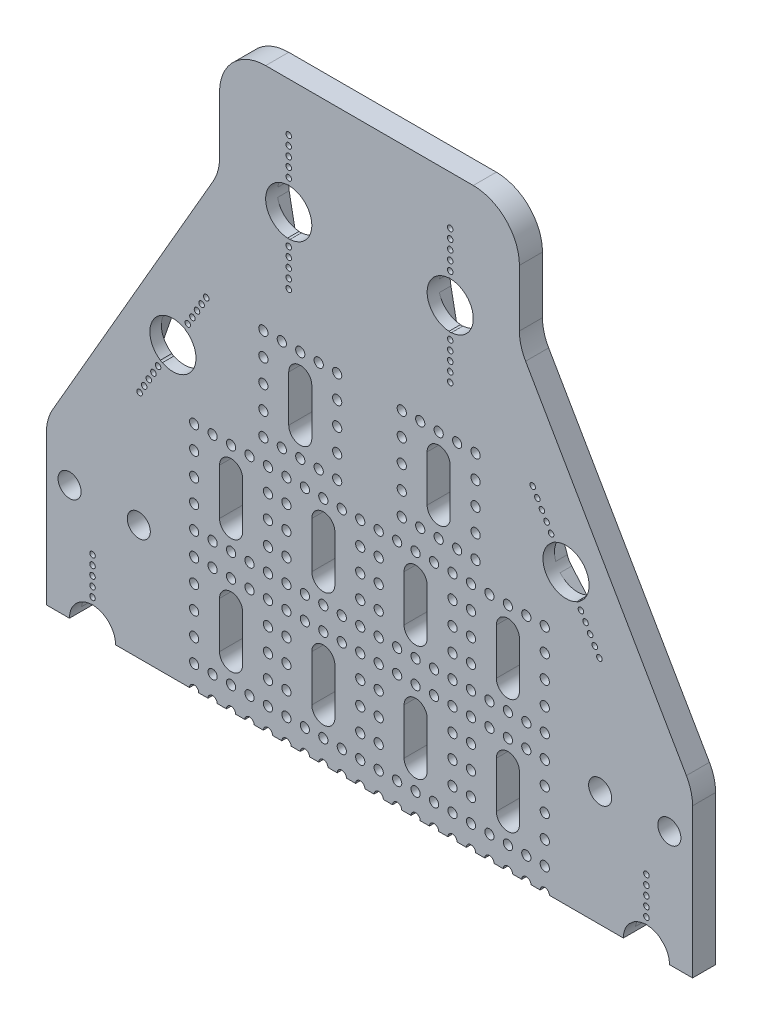
from build123d import *

# Parameters (mm, degrees)
BOSS_EXTRUDE1_DEPTH        = 2.5
SKETCH5_R                  = 1
CUT_EXTRUDE2_DEPTH         = 5
LPATTERN1_COUNT            = 4
LPATTERN1_PITCH            = 20
LPATTERN2_COPY_1_SKETCH_R  = 1
LPATTERN2_COPY_1_DEPTH     = 5
LPATTERN2_COPY_2_SKETCH_R  = 1
LPATTERN2_COPY_2_DEPTH     = 5
LPATTERN2_COPY_3_SKETCH_R  = 1
LPATTERN2_COPY_3_DEPTH     = 5
LPATTERN2_COPY_4_SKETCH_R  = 1
LPATTERN2_COPY_4_DEPTH     = 5
LPATTERN2_COPY_5_SKETCH_R  = 1
LPATTERN2_COPY_5_DEPTH     = 5
LPATTERN2_COPY_6_SKETCH_R  = 1
LPATTERN2_COPY_6_DEPTH     = 5
LPATTERN2_COPY_7_SKETCH_R  = 1
LPATTERN2_COPY_7_DEPTH     = 5
LPATTERN2_COPY_8_SKETCH_R  = 1
LPATTERN2_COPY_8_DEPTH     = 5
LPATTERN2_COPY_9_SKETCH_R  = 1
LPATTERN2_COPY_9_DEPTH     = 5
LPATTERN2_COPY_10_SKETCH_R = 1
LPATTERN2_COPY_10_DEPTH    = 5
LPATTERN2_COPY_11_SKETCH_R = 1
LPATTERN2_COPY_11_DEPTH    = 5
LPATTERN2_COPY_12_SKETCH_R = 1
LPATTERN2_COPY_12_DEPTH    = 5
SKETCH9_W                  = 65
SKETCH9_H                  = 25
BOSS_EXTRUDE6_DEPTH        = 5
SKETCH13_R                 = 1
CUT_EXTRUDE5_DEPTH         = 5
FILLET4_R                  = 10
SKETCH3_R                  = 2.5
CUT_EXTRUDE6_DEPTH         = 5
SKETCH14_R                 = 1
CUT_EXTRUDE7_DEPTH         = 5
SKETCH2_R                  = 5
CUT_EXTRUDE9_DEPTH         = 10
SKETCH15_R                 = 0.6
CUT_EXTRUDE10_DEPTH        = 10
CUT_EXTRUDE11_DEPTH        = 2.5
SKETCH20_R                 = 5
CUT_EXTRUDE12_DEPTH        = 144.366272954
SKETCH21_R                 = 0.6
CUT_EXTRUDE13_DEPTH        = 144.366272954
CUT_EXTRUDE14_DEPTH        = 2.5
SKETCH23_R                 = 2.5
CUT_EXTRUDE15_DEPTH        = 144.366272954
CUT_EXTRUDE16_START        = -10
CUT_EXTRUDE16_DEPTH        = 10


with BuildPart() as part:
    # Sketch1 → Boss-Extrude1 (new, symmetric)
    with BuildSketch(Plane.XY):
        Polygon((32.5, 100), (-32.5, 100), (-70.027767497, 35), (-70.027767497, -35), (-32.5, -100), (32.5, -100), (70.027767497, -35), (70.027767497, 35), align=None)
    extrude(amount=BOSS_EXTRUDE1_DEPTH, both=True)

    # Sketch5 → Cut-Extrude2 (cut)
    with BuildSketch(Plane(origin=(0, 0, -2.5), x_dir=(-1, 0, 0), z_dir=(0, 0, -1))):
        with BuildLine():
            Line((27.5, 45), (27.5, 35))
            ThreePointArc((27.5, 35), (30, 32.5), (32.5, 35))
            Line((32.5, 35), (32.5, 45))
            ThreePointArc((32.5, 45), (30, 47.5), (27.5, 45))
        make_face()
        with Locations((38, 50)):
            Circle(SKETCH5_R)
        with Locations((38, 45)):
            Circle(SKETCH5_R)
        with Locations((38, 40)):
            Circle(SKETCH5_R)
        with Locations((38, 35)):
            Circle(SKETCH5_R)
        with Locations((38, 30)):
            Circle(SKETCH5_R)
        with Locations((22, 30)):
            Circle(SKETCH5_R)
        with Locations((22, 35)):
            Circle(SKETCH5_R)
        with Locations((22, 40)):
            Circle(SKETCH5_R)
        with Locations((22, 45)):
            Circle(SKETCH5_R)
        with Locations((22, 50)):
            Circle(SKETCH5_R)
        with Locations((34, 50)):
            Circle(SKETCH5_R)
        with Locations((30, 50)):
            Circle(SKETCH5_R)
        with Locations((26, 50)):
            Circle(SKETCH5_R)
        with Locations((34, 30)):
            Circle(SKETCH5_R)
        with Locations((30, 30)):
            Circle(SKETCH5_R)
        with Locations((26, 30)):
            Circle(SKETCH5_R)
    cut_extrude2 = extrude(amount=-CUT_EXTRUDE2_DEPTH, mode=Mode.SUBTRACT)

    # LPattern1: Cut-Extrude2 ×4
    with Locations(*[(i * LPATTERN1_PITCH, 0, 0) for i in range(1, LPATTERN1_COUNT)]):
        add(cut_extrude2, mode=Mode.SUBTRACT)

    # LPattern2 copy 1 sketch → LPattern2 copy 1 (cut)
    with BuildSketch(Plane(origin=(20, -25, -2.5), x_dir=(-1, 0, 0), z_dir=(0, 0, -1))):
        with BuildLine():
            Line((27.5, 45), (27.5, 35))
            ThreePointArc((27.5, 35), (30, 32.5), (32.5, 35))
            Line((32.5, 35), (32.5, 45))
            ThreePointArc((32.5, 45), (30, 47.5), (27.5, 45))
        make_face()
        with Locations((38, 50)):
            Circle(LPATTERN2_COPY_1_SKETCH_R)
        with Locations((38, 45)):
            Circle(LPATTERN2_COPY_1_SKETCH_R)
        with Locations((38, 40)):
            Circle(LPATTERN2_COPY_1_SKETCH_R)
        with Locations((38, 35)):
            Circle(LPATTERN2_COPY_1_SKETCH_R)
        with Locations((38, 30)):
            Circle(LPATTERN2_COPY_1_SKETCH_R)
        with Locations((22, 30)):
            Circle(LPATTERN2_COPY_1_SKETCH_R)
        with Locations((22, 35)):
            Circle(LPATTERN2_COPY_1_SKETCH_R)
        with Locations((22, 40)):
            Circle(LPATTERN2_COPY_1_SKETCH_R)
        with Locations((22, 45)):
            Circle(LPATTERN2_COPY_1_SKETCH_R)
        with Locations((22, 50)):
            Circle(LPATTERN2_COPY_1_SKETCH_R)
        with Locations((34, 50)):
            Circle(LPATTERN2_COPY_1_SKETCH_R)
        with Locations((30, 50)):
            Circle(LPATTERN2_COPY_1_SKETCH_R)
        with Locations((26, 50)):
            Circle(LPATTERN2_COPY_1_SKETCH_R)
        with Locations((34, 30)):
            Circle(LPATTERN2_COPY_1_SKETCH_R)
        with Locations((30, 30)):
            Circle(LPATTERN2_COPY_1_SKETCH_R)
        with Locations((26, 30)):
            Circle(LPATTERN2_COPY_1_SKETCH_R)
    extrude(amount=-LPATTERN2_COPY_1_DEPTH, mode=Mode.SUBTRACT)

    # LPattern2 copy 2 sketch → LPattern2 copy 2 (cut)
    with BuildSketch(Plane(origin=(20, -50, -2.5), x_dir=(-1, 0, 0), z_dir=(0, 0, -1))):
        with BuildLine():
            Line((27.5, 45), (27.5, 35))
            ThreePointArc((27.5, 35), (30, 32.5), (32.5, 35))
            Line((32.5, 35), (32.5, 45))
            ThreePointArc((32.5, 45), (30, 47.5), (27.5, 45))
        make_face()
        with Locations((38, 50)):
            Circle(LPATTERN2_COPY_2_SKETCH_R)
        with Locations((38, 45)):
            Circle(LPATTERN2_COPY_2_SKETCH_R)
        with Locations((38, 40)):
            Circle(LPATTERN2_COPY_2_SKETCH_R)
        with Locations((38, 35)):
            Circle(LPATTERN2_COPY_2_SKETCH_R)
        with Locations((38, 30)):
            Circle(LPATTERN2_COPY_2_SKETCH_R)
        with Locations((22, 30)):
            Circle(LPATTERN2_COPY_2_SKETCH_R)
        with Locations((22, 35)):
            Circle(LPATTERN2_COPY_2_SKETCH_R)
        with Locations((22, 40)):
            Circle(LPATTERN2_COPY_2_SKETCH_R)
        with Locations((22, 45)):
            Circle(LPATTERN2_COPY_2_SKETCH_R)
        with Locations((22, 50)):
            Circle(LPATTERN2_COPY_2_SKETCH_R)
        with Locations((34, 50)):
            Circle(LPATTERN2_COPY_2_SKETCH_R)
        with Locations((30, 50)):
            Circle(LPATTERN2_COPY_2_SKETCH_R)
        with Locations((26, 50)):
            Circle(LPATTERN2_COPY_2_SKETCH_R)
        with Locations((34, 30)):
            Circle(LPATTERN2_COPY_2_SKETCH_R)
        with Locations((30, 30)):
            Circle(LPATTERN2_COPY_2_SKETCH_R)
        with Locations((26, 30)):
            Circle(LPATTERN2_COPY_2_SKETCH_R)
    extrude(amount=-LPATTERN2_COPY_2_DEPTH, mode=Mode.SUBTRACT)

    # LPattern2 copy 3 sketch → LPattern2 copy 3 (cut)
    with BuildSketch(Plane(origin=(20, -75, -2.5), x_dir=(-1, 0, 0), z_dir=(0, 0, -1))):
        with BuildLine():
            Line((27.5, 45), (27.5, 35))
            ThreePointArc((27.5, 35), (30, 32.5), (32.5, 35))
            Line((32.5, 35), (32.5, 45))
            ThreePointArc((32.5, 45), (30, 47.5), (27.5, 45))
        make_face()
        with Locations((38, 50)):
            Circle(LPATTERN2_COPY_3_SKETCH_R)
        with Locations((38, 45)):
            Circle(LPATTERN2_COPY_3_SKETCH_R)
        with Locations((38, 40)):
            Circle(LPATTERN2_COPY_3_SKETCH_R)
        with Locations((38, 35)):
            Circle(LPATTERN2_COPY_3_SKETCH_R)
        with Locations((38, 30)):
            Circle(LPATTERN2_COPY_3_SKETCH_R)
        with Locations((22, 30)):
            Circle(LPATTERN2_COPY_3_SKETCH_R)
        with Locations((22, 35)):
            Circle(LPATTERN2_COPY_3_SKETCH_R)
        with Locations((22, 40)):
            Circle(LPATTERN2_COPY_3_SKETCH_R)
        with Locations((22, 45)):
            Circle(LPATTERN2_COPY_3_SKETCH_R)
        with Locations((22, 50)):
            Circle(LPATTERN2_COPY_3_SKETCH_R)
        with Locations((34, 50)):
            Circle(LPATTERN2_COPY_3_SKETCH_R)
        with Locations((30, 50)):
            Circle(LPATTERN2_COPY_3_SKETCH_R)
        with Locations((26, 50)):
            Circle(LPATTERN2_COPY_3_SKETCH_R)
        with Locations((34, 30)):
            Circle(LPATTERN2_COPY_3_SKETCH_R)
        with Locations((30, 30)):
            Circle(LPATTERN2_COPY_3_SKETCH_R)
        with Locations((26, 30)):
            Circle(LPATTERN2_COPY_3_SKETCH_R)
    extrude(amount=-LPATTERN2_COPY_3_DEPTH, mode=Mode.SUBTRACT)

    # LPattern2 copy 4 sketch → LPattern2 copy 4 (cut)
    with BuildSketch(Plane(origin=(40, -25, -2.5), x_dir=(-1, 0, 0), z_dir=(0, 0, -1))):
        with BuildLine():
            Line((27.5, 45), (27.5, 35))
            ThreePointArc((27.5, 35), (30, 32.5), (32.5, 35))
            Line((32.5, 35), (32.5, 45))
            ThreePointArc((32.5, 45), (30, 47.5), (27.5, 45))
        make_face()
        with Locations((38, 50)):
            Circle(LPATTERN2_COPY_4_SKETCH_R)
        with Locations((38, 45)):
            Circle(LPATTERN2_COPY_4_SKETCH_R)
        with Locations((38, 40)):
            Circle(LPATTERN2_COPY_4_SKETCH_R)
        with Locations((38, 35)):
            Circle(LPATTERN2_COPY_4_SKETCH_R)
        with Locations((38, 30)):
            Circle(LPATTERN2_COPY_4_SKETCH_R)
        with Locations((22, 30)):
            Circle(LPATTERN2_COPY_4_SKETCH_R)
        with Locations((22, 35)):
            Circle(LPATTERN2_COPY_4_SKETCH_R)
        with Locations((22, 40)):
            Circle(LPATTERN2_COPY_4_SKETCH_R)
        with Locations((22, 45)):
            Circle(LPATTERN2_COPY_4_SKETCH_R)
        with Locations((22, 50)):
            Circle(LPATTERN2_COPY_4_SKETCH_R)
        with Locations((34, 50)):
            Circle(LPATTERN2_COPY_4_SKETCH_R)
        with Locations((30, 50)):
            Circle(LPATTERN2_COPY_4_SKETCH_R)
        with Locations((26, 50)):
            Circle(LPATTERN2_COPY_4_SKETCH_R)
        with Locations((34, 30)):
            Circle(LPATTERN2_COPY_4_SKETCH_R)
        with Locations((30, 30)):
            Circle(LPATTERN2_COPY_4_SKETCH_R)
        with Locations((26, 30)):
            Circle(LPATTERN2_COPY_4_SKETCH_R)
    extrude(amount=-LPATTERN2_COPY_4_DEPTH, mode=Mode.SUBTRACT)

    # LPattern2 copy 5 sketch → LPattern2 copy 5 (cut)
    with BuildSketch(Plane(origin=(40, -50, -2.5), x_dir=(-1, 0, 0), z_dir=(0, 0, -1))):
        with BuildLine():
            Line((27.5, 45), (27.5, 35))
            ThreePointArc((27.5, 35), (30, 32.5), (32.5, 35))
            Line((32.5, 35), (32.5, 45))
            ThreePointArc((32.5, 45), (30, 47.5), (27.5, 45))
        make_face()
        with Locations((38, 50)):
            Circle(LPATTERN2_COPY_5_SKETCH_R)
        with Locations((38, 45)):
            Circle(LPATTERN2_COPY_5_SKETCH_R)
        with Locations((38, 40)):
            Circle(LPATTERN2_COPY_5_SKETCH_R)
        with Locations((38, 35)):
            Circle(LPATTERN2_COPY_5_SKETCH_R)
        with Locations((38, 30)):
            Circle(LPATTERN2_COPY_5_SKETCH_R)
        with Locations((22, 30)):
            Circle(LPATTERN2_COPY_5_SKETCH_R)
        with Locations((22, 35)):
            Circle(LPATTERN2_COPY_5_SKETCH_R)
        with Locations((22, 40)):
            Circle(LPATTERN2_COPY_5_SKETCH_R)
        with Locations((22, 45)):
            Circle(LPATTERN2_COPY_5_SKETCH_R)
        with Locations((22, 50)):
            Circle(LPATTERN2_COPY_5_SKETCH_R)
        with Locations((34, 50)):
            Circle(LPATTERN2_COPY_5_SKETCH_R)
        with Locations((30, 50)):
            Circle(LPATTERN2_COPY_5_SKETCH_R)
        with Locations((26, 50)):
            Circle(LPATTERN2_COPY_5_SKETCH_R)
        with Locations((34, 30)):
            Circle(LPATTERN2_COPY_5_SKETCH_R)
        with Locations((30, 30)):
            Circle(LPATTERN2_COPY_5_SKETCH_R)
        with Locations((26, 30)):
            Circle(LPATTERN2_COPY_5_SKETCH_R)
    extrude(amount=-LPATTERN2_COPY_5_DEPTH, mode=Mode.SUBTRACT)

    # LPattern2 copy 6 sketch → LPattern2 copy 6 (cut)
    with BuildSketch(Plane(origin=(40, -75, -2.5), x_dir=(-1, 0, 0), z_dir=(0, 0, -1))):
        with BuildLine():
            Line((27.5, 45), (27.5, 35))
            ThreePointArc((27.5, 35), (30, 32.5), (32.5, 35))
            Line((32.5, 35), (32.5, 45))
            ThreePointArc((32.5, 45), (30, 47.5), (27.5, 45))
        make_face()
        with Locations((38, 50)):
            Circle(LPATTERN2_COPY_6_SKETCH_R)
        with Locations((38, 45)):
            Circle(LPATTERN2_COPY_6_SKETCH_R)
        with Locations((38, 40)):
            Circle(LPATTERN2_COPY_6_SKETCH_R)
        with Locations((38, 35)):
            Circle(LPATTERN2_COPY_6_SKETCH_R)
        with Locations((38, 30)):
            Circle(LPATTERN2_COPY_6_SKETCH_R)
        with Locations((22, 30)):
            Circle(LPATTERN2_COPY_6_SKETCH_R)
        with Locations((22, 35)):
            Circle(LPATTERN2_COPY_6_SKETCH_R)
        with Locations((22, 40)):
            Circle(LPATTERN2_COPY_6_SKETCH_R)
        with Locations((22, 45)):
            Circle(LPATTERN2_COPY_6_SKETCH_R)
        with Locations((22, 50)):
            Circle(LPATTERN2_COPY_6_SKETCH_R)
        with Locations((34, 50)):
            Circle(LPATTERN2_COPY_6_SKETCH_R)
        with Locations((30, 50)):
            Circle(LPATTERN2_COPY_6_SKETCH_R)
        with Locations((26, 50)):
            Circle(LPATTERN2_COPY_6_SKETCH_R)
        with Locations((34, 30)):
            Circle(LPATTERN2_COPY_6_SKETCH_R)
        with Locations((30, 30)):
            Circle(LPATTERN2_COPY_6_SKETCH_R)
        with Locations((26, 30)):
            Circle(LPATTERN2_COPY_6_SKETCH_R)
    extrude(amount=-LPATTERN2_COPY_6_DEPTH, mode=Mode.SUBTRACT)

    # LPattern2 copy 7 sketch → LPattern2 copy 7 (cut)
    with BuildSketch(Plane(origin=(60, -25, -2.5), x_dir=(-1, 0, 0), z_dir=(0, 0, -1))):
        with BuildLine():
            Line((27.5, 45), (27.5, 35))
            ThreePointArc((27.5, 35), (30, 32.5), (32.5, 35))
            Line((32.5, 35), (32.5, 45))
            ThreePointArc((32.5, 45), (30, 47.5), (27.5, 45))
        make_face()
        with Locations((38, 50)):
            Circle(LPATTERN2_COPY_7_SKETCH_R)
        with Locations((38, 45)):
            Circle(LPATTERN2_COPY_7_SKETCH_R)
        with Locations((38, 40)):
            Circle(LPATTERN2_COPY_7_SKETCH_R)
        with Locations((38, 35)):
            Circle(LPATTERN2_COPY_7_SKETCH_R)
        with Locations((38, 30)):
            Circle(LPATTERN2_COPY_7_SKETCH_R)
        with Locations((22, 30)):
            Circle(LPATTERN2_COPY_7_SKETCH_R)
        with Locations((22, 35)):
            Circle(LPATTERN2_COPY_7_SKETCH_R)
        with Locations((22, 40)):
            Circle(LPATTERN2_COPY_7_SKETCH_R)
        with Locations((22, 45)):
            Circle(LPATTERN2_COPY_7_SKETCH_R)
        with Locations((22, 50)):
            Circle(LPATTERN2_COPY_7_SKETCH_R)
        with Locations((34, 50)):
            Circle(LPATTERN2_COPY_7_SKETCH_R)
        with Locations((30, 50)):
            Circle(LPATTERN2_COPY_7_SKETCH_R)
        with Locations((26, 50)):
            Circle(LPATTERN2_COPY_7_SKETCH_R)
        with Locations((34, 30)):
            Circle(LPATTERN2_COPY_7_SKETCH_R)
        with Locations((30, 30)):
            Circle(LPATTERN2_COPY_7_SKETCH_R)
        with Locations((26, 30)):
            Circle(LPATTERN2_COPY_7_SKETCH_R)
    extrude(amount=-LPATTERN2_COPY_7_DEPTH, mode=Mode.SUBTRACT)

    # LPattern2 copy 8 sketch → LPattern2 copy 8 (cut)
    with BuildSketch(Plane(origin=(60, -50, -2.5), x_dir=(-1, 0, 0), z_dir=(0, 0, -1))):
        with BuildLine():
            Line((27.5, 45), (27.5, 35))
            ThreePointArc((27.5, 35), (30, 32.5), (32.5, 35))
            Line((32.5, 35), (32.5, 45))
            ThreePointArc((32.5, 45), (30, 47.5), (27.5, 45))
        make_face()
        with Locations((38, 50)):
            Circle(LPATTERN2_COPY_8_SKETCH_R)
        with Locations((38, 45)):
            Circle(LPATTERN2_COPY_8_SKETCH_R)
        with Locations((38, 40)):
            Circle(LPATTERN2_COPY_8_SKETCH_R)
        with Locations((38, 35)):
            Circle(LPATTERN2_COPY_8_SKETCH_R)
        with Locations((38, 30)):
            Circle(LPATTERN2_COPY_8_SKETCH_R)
        with Locations((22, 30)):
            Circle(LPATTERN2_COPY_8_SKETCH_R)
        with Locations((22, 35)):
            Circle(LPATTERN2_COPY_8_SKETCH_R)
        with Locations((22, 40)):
            Circle(LPATTERN2_COPY_8_SKETCH_R)
        with Locations((22, 45)):
            Circle(LPATTERN2_COPY_8_SKETCH_R)
        with Locations((22, 50)):
            Circle(LPATTERN2_COPY_8_SKETCH_R)
        with Locations((34, 50)):
            Circle(LPATTERN2_COPY_8_SKETCH_R)
        with Locations((30, 50)):
            Circle(LPATTERN2_COPY_8_SKETCH_R)
        with Locations((26, 50)):
            Circle(LPATTERN2_COPY_8_SKETCH_R)
        with Locations((34, 30)):
            Circle(LPATTERN2_COPY_8_SKETCH_R)
        with Locations((30, 30)):
            Circle(LPATTERN2_COPY_8_SKETCH_R)
        with Locations((26, 30)):
            Circle(LPATTERN2_COPY_8_SKETCH_R)
    extrude(amount=-LPATTERN2_COPY_8_DEPTH, mode=Mode.SUBTRACT)

    # LPattern2 copy 9 sketch → LPattern2 copy 9 (cut)
    with BuildSketch(Plane(origin=(60, -75, -2.5), x_dir=(-1, 0, 0), z_dir=(0, 0, -1))):
        with BuildLine():
            Line((27.5, 45), (27.5, 35))
            ThreePointArc((27.5, 35), (30, 32.5), (32.5, 35))
            Line((32.5, 35), (32.5, 45))
            ThreePointArc((32.5, 45), (30, 47.5), (27.5, 45))
        make_face()
        with Locations((38, 50)):
            Circle(LPATTERN2_COPY_9_SKETCH_R)
        with Locations((38, 45)):
            Circle(LPATTERN2_COPY_9_SKETCH_R)
        with Locations((38, 40)):
            Circle(LPATTERN2_COPY_9_SKETCH_R)
        with Locations((38, 35)):
            Circle(LPATTERN2_COPY_9_SKETCH_R)
        with Locations((38, 30)):
            Circle(LPATTERN2_COPY_9_SKETCH_R)
        with Locations((22, 30)):
            Circle(LPATTERN2_COPY_9_SKETCH_R)
        with Locations((22, 35)):
            Circle(LPATTERN2_COPY_9_SKETCH_R)
        with Locations((22, 40)):
            Circle(LPATTERN2_COPY_9_SKETCH_R)
        with Locations((22, 45)):
            Circle(LPATTERN2_COPY_9_SKETCH_R)
        with Locations((22, 50)):
            Circle(LPATTERN2_COPY_9_SKETCH_R)
        with Locations((34, 50)):
            Circle(LPATTERN2_COPY_9_SKETCH_R)
        with Locations((30, 50)):
            Circle(LPATTERN2_COPY_9_SKETCH_R)
        with Locations((26, 50)):
            Circle(LPATTERN2_COPY_9_SKETCH_R)
        with Locations((34, 30)):
            Circle(LPATTERN2_COPY_9_SKETCH_R)
        with Locations((30, 30)):
            Circle(LPATTERN2_COPY_9_SKETCH_R)
        with Locations((26, 30)):
            Circle(LPATTERN2_COPY_9_SKETCH_R)
    extrude(amount=-LPATTERN2_COPY_9_DEPTH, mode=Mode.SUBTRACT)

    # LPattern2 copy 10 sketch → LPattern2 copy 10 (cut)
    with BuildSketch(Plane(origin=(0, -25, -2.5), x_dir=(-1, 0, 0), z_dir=(0, 0, -1))):
        with BuildLine():
            Line((27.5, 45), (27.5, 35))
            ThreePointArc((27.5, 35), (30, 32.5), (32.5, 35))
            Line((32.5, 35), (32.5, 45))
            ThreePointArc((32.5, 45), (30, 47.5), (27.5, 45))
        make_face()
        with Locations((38, 50)):
            Circle(LPATTERN2_COPY_10_SKETCH_R)
        with Locations((38, 45)):
            Circle(LPATTERN2_COPY_10_SKETCH_R)
        with Locations((38, 40)):
            Circle(LPATTERN2_COPY_10_SKETCH_R)
        with Locations((38, 35)):
            Circle(LPATTERN2_COPY_10_SKETCH_R)
        with Locations((38, 30)):
            Circle(LPATTERN2_COPY_10_SKETCH_R)
        with Locations((22, 30)):
            Circle(LPATTERN2_COPY_10_SKETCH_R)
        with Locations((22, 35)):
            Circle(LPATTERN2_COPY_10_SKETCH_R)
        with Locations((22, 40)):
            Circle(LPATTERN2_COPY_10_SKETCH_R)
        with Locations((22, 45)):
            Circle(LPATTERN2_COPY_10_SKETCH_R)
        with Locations((22, 50)):
            Circle(LPATTERN2_COPY_10_SKETCH_R)
        with Locations((34, 50)):
            Circle(LPATTERN2_COPY_10_SKETCH_R)
        with Locations((30, 50)):
            Circle(LPATTERN2_COPY_10_SKETCH_R)
        with Locations((26, 50)):
            Circle(LPATTERN2_COPY_10_SKETCH_R)
        with Locations((34, 30)):
            Circle(LPATTERN2_COPY_10_SKETCH_R)
        with Locations((30, 30)):
            Circle(LPATTERN2_COPY_10_SKETCH_R)
        with Locations((26, 30)):
            Circle(LPATTERN2_COPY_10_SKETCH_R)
    extrude(amount=-LPATTERN2_COPY_10_DEPTH, mode=Mode.SUBTRACT)

    # LPattern2 copy 11 sketch → LPattern2 copy 11 (cut)
    with BuildSketch(Plane(origin=(0, -50, -2.5), x_dir=(-1, 0, 0), z_dir=(0, 0, -1))):
        with BuildLine():
            Line((27.5, 45), (27.5, 35))
            ThreePointArc((27.5, 35), (30, 32.5), (32.5, 35))
            Line((32.5, 35), (32.5, 45))
            ThreePointArc((32.5, 45), (30, 47.5), (27.5, 45))
        make_face()
        with Locations((38, 50)):
            Circle(LPATTERN2_COPY_11_SKETCH_R)
        with Locations((38, 45)):
            Circle(LPATTERN2_COPY_11_SKETCH_R)
        with Locations((38, 40)):
            Circle(LPATTERN2_COPY_11_SKETCH_R)
        with Locations((38, 35)):
            Circle(LPATTERN2_COPY_11_SKETCH_R)
        with Locations((38, 30)):
            Circle(LPATTERN2_COPY_11_SKETCH_R)
        with Locations((22, 30)):
            Circle(LPATTERN2_COPY_11_SKETCH_R)
        with Locations((22, 35)):
            Circle(LPATTERN2_COPY_11_SKETCH_R)
        with Locations((22, 40)):
            Circle(LPATTERN2_COPY_11_SKETCH_R)
        with Locations((22, 45)):
            Circle(LPATTERN2_COPY_11_SKETCH_R)
        with Locations((22, 50)):
            Circle(LPATTERN2_COPY_11_SKETCH_R)
        with Locations((34, 50)):
            Circle(LPATTERN2_COPY_11_SKETCH_R)
        with Locations((30, 50)):
            Circle(LPATTERN2_COPY_11_SKETCH_R)
        with Locations((26, 50)):
            Circle(LPATTERN2_COPY_11_SKETCH_R)
        with Locations((34, 30)):
            Circle(LPATTERN2_COPY_11_SKETCH_R)
        with Locations((30, 30)):
            Circle(LPATTERN2_COPY_11_SKETCH_R)
        with Locations((26, 30)):
            Circle(LPATTERN2_COPY_11_SKETCH_R)
    extrude(amount=-LPATTERN2_COPY_11_DEPTH, mode=Mode.SUBTRACT)

    # LPattern2 copy 12 sketch → LPattern2 copy 12 (cut)
    with BuildSketch(Plane(origin=(0, -75, -2.5), x_dir=(-1, 0, 0), z_dir=(0, 0, -1))):
        with BuildLine():
            Line((27.5, 45), (27.5, 35))
            ThreePointArc((27.5, 35), (30, 32.5), (32.5, 35))
            Line((32.5, 35), (32.5, 45))
            ThreePointArc((32.5, 45), (30, 47.5), (27.5, 45))
        make_face()
        with Locations((38, 50)):
            Circle(LPATTERN2_COPY_12_SKETCH_R)
        with Locations((38, 45)):
            Circle(LPATTERN2_COPY_12_SKETCH_R)
        with Locations((38, 40)):
            Circle(LPATTERN2_COPY_12_SKETCH_R)
        with Locations((38, 35)):
            Circle(LPATTERN2_COPY_12_SKETCH_R)
        with Locations((38, 30)):
            Circle(LPATTERN2_COPY_12_SKETCH_R)
        with Locations((22, 30)):
            Circle(LPATTERN2_COPY_12_SKETCH_R)
        with Locations((22, 35)):
            Circle(LPATTERN2_COPY_12_SKETCH_R)
        with Locations((22, 40)):
            Circle(LPATTERN2_COPY_12_SKETCH_R)
        with Locations((22, 45)):
            Circle(LPATTERN2_COPY_12_SKETCH_R)
        with Locations((22, 50)):
            Circle(LPATTERN2_COPY_12_SKETCH_R)
        with Locations((34, 50)):
            Circle(LPATTERN2_COPY_12_SKETCH_R)
        with Locations((30, 50)):
            Circle(LPATTERN2_COPY_12_SKETCH_R)
        with Locations((26, 50)):
            Circle(LPATTERN2_COPY_12_SKETCH_R)
        with Locations((34, 30)):
            Circle(LPATTERN2_COPY_12_SKETCH_R)
        with Locations((30, 30)):
            Circle(LPATTERN2_COPY_12_SKETCH_R)
        with Locations((26, 30)):
            Circle(LPATTERN2_COPY_12_SKETCH_R)
    extrude(amount=-LPATTERN2_COPY_12_DEPTH, mode=Mode.SUBTRACT)

    # Sketch9 → Boss-Extrude6 (add)
    with BuildSketch(Plane(origin=(0, 0, -2.5), x_dir=(-1, 0, 0), z_dir=(0, 0, -1))):
        with Locations((0, 112.5)):
            Rectangle(SKETCH9_W, SKETCH9_H)
    extrude(amount=-BOSS_EXTRUDE6_DEPTH)

    # Sketch13 → Cut-Extrude5 (cut)
    with BuildSketch(Plane(origin=(0, 0, -2.5), x_dir=(-1, 0, 0), z_dir=(0, 0, -1))):
        with BuildLine():
            Line((12.5, 70), (12.5, 60))
            ThreePointArc((12.5, 60), (15, 57.5), (17.5, 60))
            Line((17.5, 60), (17.5, 70))
            ThreePointArc((17.5, 70), (15, 72.5), (12.5, 70))
        make_face()
        with BuildLine():
            Line((-17.5, 70), (-17.5, 60))
            ThreePointArc((-17.5, 60), (-15, 57.5), (-12.5, 60))
            Line((-12.5, 60), (-12.5, 70))
            ThreePointArc((-12.5, 70), (-15, 72.5), (-17.5, 70))
        make_face()
        with Locations((23, 75)):
            Circle(SKETCH13_R)
        with Locations((23, 70)):
            Circle(SKETCH13_R)
        with Locations((23, 65)):
            Circle(SKETCH13_R)
        with Locations((23, 60)):
            Circle(SKETCH13_R)
        with Locations((23, 55)):
            Circle(SKETCH13_R)
        with Locations((7, 55)):
            Circle(SKETCH13_R)
        with Locations((7, 60)):
            Circle(SKETCH13_R)
        with Locations((7, 65)):
            Circle(SKETCH13_R)
        with Locations((7, 70)):
            Circle(SKETCH13_R)
        with Locations((7, 75)):
            Circle(SKETCH13_R)
        with Locations((19, 75)):
            Circle(SKETCH13_R)
        with Locations((15, 75)):
            Circle(SKETCH13_R)
        with Locations((11, 75)):
            Circle(SKETCH13_R)
        with Locations((19, 55)):
            Circle(SKETCH13_R)
        with Locations((15, 55)):
            Circle(SKETCH13_R)
        with Locations((11, 55)):
            Circle(SKETCH13_R)
        with Locations((-11, 55)):
            Circle(SKETCH13_R)
        with Locations((-15, 55)):
            Circle(SKETCH13_R)
        with Locations((-19, 55)):
            Circle(SKETCH13_R)
        with Locations((-11, 75)):
            Circle(SKETCH13_R)
        with Locations((-15, 75)):
            Circle(SKETCH13_R)
        with Locations((-19, 75)):
            Circle(SKETCH13_R)
        with Locations((-7, 75)):
            Circle(SKETCH13_R)
        with Locations((-7, 70)):
            Circle(SKETCH13_R)
        with Locations((-7, 65)):
            Circle(SKETCH13_R)
        with Locations((-7, 60)):
            Circle(SKETCH13_R)
        with Locations((-7, 55)):
            Circle(SKETCH13_R)
        with Locations((-23, 55)):
            Circle(SKETCH13_R)
        with Locations((-23, 60)):
            Circle(SKETCH13_R)
        with Locations((-23, 65)):
            Circle(SKETCH13_R)
        with Locations((-23, 70)):
            Circle(SKETCH13_R)
        with Locations((-23, 75)):
            Circle(SKETCH13_R)
    extrude(amount=-CUT_EXTRUDE5_DEPTH, mode=Mode.SUBTRACT)

    # Fillet4
    fillet4_edges = [part.edges().sort_by_distance(p)[0] for p in [
        (70.027767497, -35, 0),
        (-32.5, -100, 0),
        (32.5, -100, 0),
        (-70.027767497, -35, 0),
        (-70.027767497, 35, 0),
        (70.027767497, 35, 0),
        (32.5, 100, 0),
        (-32.5, 100, 0),
        (-32.5, 125, 0),
        (32.5, 125, 0),
    ]]
    fillet(fillet4_edges, radius=FILLET4_R)

    # Sketch3 → Cut-Extrude6 (cut)
    with BuildSketch(Plane(origin=(0, 0, -2.5), x_dir=(-1, 0, 0), z_dir=(0, 0, -1))):
        with Locations((17.67766953, -57.32233047)):
            Circle(SKETCH3_R)
        with Locations((-17.67766953, -57.32233047)):
            Circle(SKETCH3_R)
        with Locations((17.67766953, -92.67766953)):
            Circle(SKETCH3_R)
        with Locations((-17.67766953, -92.67766953)):
            Circle(SKETCH3_R)
    extrude(amount=-CUT_EXTRUDE6_DEPTH, mode=Mode.SUBTRACT)

    # Sketch14 → Cut-Extrude7 (cut)
    with BuildSketch(Plane(origin=(0, 0, -2.5), x_dir=(-1, 0, 0), z_dir=(0, 0, -1))):
        with BuildLine():
            Line((-2.5, -70), (-2.5, -80))
            ThreePointArc((-2.5, -80), (0, -82.5), (2.5, -80))
            Line((2.5, -80), (2.5, -70))
            ThreePointArc((2.5, -70), (0, -67.5), (-2.5, -70))
        make_face()
        with Locations((8, -65)):
            Circle(SKETCH14_R)
        with Locations((8, -70)):
            Circle(SKETCH14_R)
        with Locations((8, -75)):
            Circle(SKETCH14_R)
        with Locations((8, -80)):
            Circle(SKETCH14_R)
        with Locations((8, -85)):
            Circle(SKETCH14_R)
        with Locations((-8, -85)):
            Circle(SKETCH14_R)
        with Locations((-8, -80)):
            Circle(SKETCH14_R)
        with Locations((-8, -75)):
            Circle(SKETCH14_R)
        with Locations((-8, -70)):
            Circle(SKETCH14_R)
        with Locations((-8, -65)):
            Circle(SKETCH14_R)
        with Locations((4, -65)):
            Circle(SKETCH14_R)
        with Locations((0, -65)):
            Circle(SKETCH14_R)
        with Locations((-4, -65)):
            Circle(SKETCH14_R)
        with Locations((4, -85)):
            Circle(SKETCH14_R)
        with Locations((0, -85)):
            Circle(SKETCH14_R)
        with Locations((-4, -85)):
            Circle(SKETCH14_R)
    extrude(amount=-CUT_EXTRUDE7_DEPTH, mode=Mode.SUBTRACT)

    # Sketch2 → Cut-Extrude9 (cut)
    with BuildSketch(Plane(origin=(0, 0, -2.5), x_dir=(-1, 0, 0), z_dir=(0, 0, -1))):
        with BuildLine():
            ThreePointArc((-56.330934918, 3.366515837), (-56.709449482, 3.650149817), (-57.027767497, 4))
            ThreePointArc((-57.027767497, 4), (-60.027767497, 5), (-63.027767497, 4))
            ThreePointArc((-63.027767497, 4), (-63.346085512, 3.650149817), (-63.724600077, 3.366515837))
            ThreePointArc((-63.724600077, 3.366515837), (-65.027767497, 0), (-63.724600077, -3.366515837))
            ThreePointArc((-63.724600077, -3.366515837), (-63.346085512, -3.650149817), (-63.027767497, -4))
            ThreePointArc((-63.027767497, -4), (-60.027767497, -5), (-57.027767497, -4))
            ThreePointArc((-57.027767497, -4), (-56.709449482, -3.650149817), (-56.330934918, -3.366515837))
            ThreePointArc((-56.330934918, -3.366515837), (-55.027767497, 0), (-56.330934918, 3.366515837))
        make_face()
        with Locations((-42.603629711, 62.5)):
            Circle(SKETCH2_R)
        with Locations((-42.603629711, -62.5)):
            Circle(SKETCH2_R)
        with Locations((42.603629711, -62.5)):
            Circle(SKETCH2_R)
        with Locations((60.027767497, 0)):
            Circle(SKETCH2_R)
        with Locations((42.603629711, 62.5)):
            Circle(SKETCH2_R)
    extrude(amount=-CUT_EXTRUDE9_DEPTH, mode=Mode.SUBTRACT)

    # Sketch15 → Cut-Extrude10 (cut)
    with BuildSketch(Plane(origin=(0, 0, -2.5), x_dir=(-1, 0, 0), z_dir=(0, 0, -1))):
        with Locations((-40.378629711, 66.353813047)):
            Circle(SKETCH15_R)
        with Locations((-39.378629711, 68.085863854)):
            Circle(SKETCH15_R)
        with Locations((-38.378629711, 69.817914662)):
            Circle(SKETCH15_R)
        with Locations((-37.378629711, 71.54996547)):
            Circle(SKETCH15_R)
        with Locations((-36.378629711, 73.282016277)):
            Circle(SKETCH15_R)
        with Locations((-35.378629711, 75.014067085)):
            Circle(SKETCH15_R)
        with Locations((-49.828629711, 49.985932915)):
            Circle(SKETCH15_R)
        with Locations((-48.828629711, 51.717983723)):
            Circle(SKETCH15_R)
        with Locations((-47.828629711, 53.45003453)):
            Circle(SKETCH15_R)
        with Locations((-46.828629711, 55.182085338)):
            Circle(SKETCH15_R)
        with Locations((-45.828629711, 56.914136146)):
            Circle(SKETCH15_R)
        with Locations((-44.828629711, 58.646186953)):
            Circle(SKETCH15_R)
        with Locations((-60.027767497, 4.45)):
            Circle(SKETCH15_R)
        with Locations((-60.027767497, 6.45)):
            Circle(SKETCH15_R)
        with Locations((-60.027767497, 8.45)):
            Circle(SKETCH15_R)
        with Locations((-60.027767497, 10.45)):
            Circle(SKETCH15_R)
        with Locations((-60.027767497, 12.45)):
            Circle(SKETCH15_R)
        with Locations((-60.027767497, 14.45)):
            Circle(SKETCH15_R)
        with Locations((-60.027767497, -14.45)):
            Circle(SKETCH15_R)
        with Locations((-60.027767497, -12.45)):
            Circle(SKETCH15_R)
        with Locations((-60.027767497, -10.45)):
            Circle(SKETCH15_R)
        with Locations((-60.027767497, -8.45)):
            Circle(SKETCH15_R)
        with Locations((-60.027767497, -6.45)):
            Circle(SKETCH15_R)
        with Locations((-60.027767497, -4.45)):
            Circle(SKETCH15_R)
        with Locations((-44.828629711, -58.646186953)):
            Circle(SKETCH15_R)
        with Locations((-45.828629711, -56.914136146)):
            Circle(SKETCH15_R)
        with Locations((-46.828629711, -55.182085338)):
            Circle(SKETCH15_R)
        with Locations((-47.828629711, -53.45003453)):
            Circle(SKETCH15_R)
        with Locations((-48.828629711, -51.717983723)):
            Circle(SKETCH15_R)
        with Locations((-49.828629711, -49.985932915)):
            Circle(SKETCH15_R)
        with Locations((-35.378629711, -75.014067085)):
            Circle(SKETCH15_R)
        with Locations((-36.378629711, -73.282016277)):
            Circle(SKETCH15_R)
        with Locations((-37.378629711, -71.54996547)):
            Circle(SKETCH15_R)
        with Locations((-38.378629711, -69.817914662)):
            Circle(SKETCH15_R)
        with Locations((-39.378629711, -68.085863854)):
            Circle(SKETCH15_R)
        with Locations((-40.378629711, -66.353813047)):
            Circle(SKETCH15_R)
        with Locations((40.378629711, -66.353813047)):
            Circle(SKETCH15_R)
        with Locations((39.378629711, -68.085863854)):
            Circle(SKETCH15_R)
        with Locations((38.378629711, -69.817914662)):
            Circle(SKETCH15_R)
        with Locations((37.378629711, -71.54996547)):
            Circle(SKETCH15_R)
        with Locations((36.378629711, -73.282016277)):
            Circle(SKETCH15_R)
        with Locations((35.378629711, -75.014067085)):
            Circle(SKETCH15_R)
        with Locations((49.828629711, -49.985932915)):
            Circle(SKETCH15_R)
        with Locations((48.828629711, -51.717983723)):
            Circle(SKETCH15_R)
        with Locations((47.828629711, -53.45003453)):
            Circle(SKETCH15_R)
        with Locations((46.828629711, -55.182085338)):
            Circle(SKETCH15_R)
        with Locations((45.828629711, -56.914136146)):
            Circle(SKETCH15_R)
        with Locations((44.828629711, -58.646186953)):
            Circle(SKETCH15_R)
        with Locations((60.027767497, -4.45)):
            Circle(SKETCH15_R)
        with Locations((60.027767497, -6.45)):
            Circle(SKETCH15_R)
        with Locations((60.027767497, -8.45)):
            Circle(SKETCH15_R)
        with Locations((60.027767497, -10.45)):
            Circle(SKETCH15_R)
        with Locations((60.027767497, -12.45)):
            Circle(SKETCH15_R)
        with Locations((60.027767497, -14.45)):
            Circle(SKETCH15_R)
        with Locations((60.027767497, 14.45)):
            Circle(SKETCH15_R)
        with Locations((60.027767497, 12.45)):
            Circle(SKETCH15_R)
        with Locations((60.027767497, 10.45)):
            Circle(SKETCH15_R)
        with Locations((60.027767497, 8.45)):
            Circle(SKETCH15_R)
        with Locations((60.027767497, 6.45)):
            Circle(SKETCH15_R)
        with Locations((60.027767497, 4.45)):
            Circle(SKETCH15_R)
        with Locations((44.828629711, 58.646186953)):
            Circle(SKETCH15_R)
        with Locations((45.828629711, 56.914136146)):
            Circle(SKETCH15_R)
        with Locations((46.828629711, 55.182085338)):
            Circle(SKETCH15_R)
        with Locations((47.828629711, 53.45003453)):
            Circle(SKETCH15_R)
        with Locations((48.828629711, 51.717983723)):
            Circle(SKETCH15_R)
        with Locations((49.828629711, 49.985932915)):
            Circle(SKETCH15_R)
        with Locations((35.378629711, 75.014067085)):
            Circle(SKETCH15_R)
        with Locations((36.378629711, 73.282016277)):
            Circle(SKETCH15_R)
        with Locations((37.378629711, 71.54996547)):
            Circle(SKETCH15_R)
        with Locations((38.378629711, 69.817914662)):
            Circle(SKETCH15_R)
        with Locations((39.378629711, 68.085863854)):
            Circle(SKETCH15_R)
        with Locations((40.378629711, 66.353813047)):
            Circle(SKETCH15_R)
    extrude(amount=-CUT_EXTRUDE10_DEPTH, mode=Mode.SUBTRACT)

    # Sketch16 → Cut-Extrude11 (cut)
    with BuildSketch(Plane(origin=(0, 0, -2.5), x_dir=(-1, 0, 0), z_dir=(0, 0, -1))):
        with BuildLine():
            Line((-37.077474248, 76.489339005), (-46.378839793, 65.778382045))
            ThreePointArc((-46.378839793, 65.778382045), (-46.93375673, 65), (-47.330396886, 64.130236813))
            Line((-47.330396886, 64.130236813), (-51.95567494, 50.719539481))
            ThreePointArc((-51.95567494, 50.719539481), (-50.953629711, 48.037375757), (-48.129785174, 48.510660995))
            Line((-48.129785174, 48.510660995), (-38.828419629, 59.221617955))
            ThreePointArc((-38.828419629, 59.221617955), (-38.273502692, 60), (-37.876862535, 60.869763187))
            Line((-37.876862535, 60.869763187), (-33.251584482, 74.280460519))
            ThreePointArc((-33.251584482, 74.280460519), (-34.253629711, 76.962624243), (-37.077474248, 76.489339005))
        make_face()
        with BuildLine():
            Line((-55.119148639, 0.951557093), (-57.81888905, 14.878200895))
            ThreePointArc((-57.81888905, 14.878200895), (-60.027767601, 16.7), (-62.236645984, 14.878200692))
            Line((-62.236645984, 14.878200692), (-64.936386356, 0.951557093))
            ThreePointArc((-64.936386356, 0.951557093), (-65.027767497, 0), (-64.936386356, -0.951557093))
            Line((-64.936386356, -0.951557093), (-62.236645984, -14.878200692))
            ThreePointArc((-62.236645984, -14.878200692), (-60.027767601, -16.7), (-57.81888905, -14.878200895))
            Line((-57.81888905, -14.878200895), (-55.119148639, -0.951557093))
            ThreePointArc((-55.119148639, -0.951557093), (-55.027767497, 0), (-55.119148639, 0.951557093))
        make_face()
        with BuildLine():
            Line((-51.95567494, -50.719539481), (-47.330396886, -64.130236813))
            ThreePointArc((-47.330396886, -64.130236813), (-46.93375673, -65), (-46.378839793, -65.778382045))
            Line((-46.378839793, -65.778382045), (-37.077474248, -76.489339005))
            ThreePointArc((-37.077474248, -76.489339005), (-34.253629711, -76.962624243), (-33.251584482, -74.280460519))
            Line((-33.251584482, -74.280460519), (-37.876862535, -60.869763187))
            ThreePointArc((-37.876862535, -60.869763187), (-38.273502692, -60), (-38.828419629, -59.221617955))
            Line((-38.828419629, -59.221617955), (-48.129785174, -48.510660995))
            ThreePointArc((-48.129785174, -48.510660995), (-50.953629711, -48.037375757), (-51.95567494, -50.719539481))
        make_face()
        with BuildLine():
            Line((37.077474248, -76.489339005), (46.378839793, -65.778382045))
            ThreePointArc((46.378839793, -65.778382045), (46.93375673, -65), (47.330396886, -64.130236813))
            Line((47.330396886, -64.130236813), (51.95567494, -50.719539481))
            ThreePointArc((51.95567494, -50.719539481), (50.953629711, -48.037375757), (48.129785174, -48.510660995))
            Line((48.129785174, -48.510660995), (38.828419629, -59.221617955))
            ThreePointArc((38.828419629, -59.221617955), (38.273502692, -60), (37.876862535, -60.869763187))
            Line((37.876862535, -60.869763187), (33.251584482, -74.280460519))
            ThreePointArc((33.251584482, -74.280460519), (34.253629711, -76.962624243), (37.077474248, -76.489339005))
        make_face()
        with BuildLine():
            Line((55.119148639, -0.951557093), (57.81888905, -14.878200895))
            ThreePointArc((57.81888905, -14.878200895), (60.027767601, -16.7), (62.236645984, -14.878200692))
            Line((62.236645984, -14.878200692), (64.936386356, -0.951557093))
            ThreePointArc((64.936386356, -0.951557093), (65.027767497, 0), (64.936386356, 0.951557093))
            Line((64.936386356, 0.951557093), (62.236645984, 14.878200692))
            ThreePointArc((62.236645984, 14.878200692), (60.027767601, 16.7), (57.81888905, 14.878200895))
            Line((57.81888905, 14.878200895), (55.119148639, 0.951557093))
            ThreePointArc((55.119148639, 0.951557093), (55.027767497, 0), (55.119148639, -0.951557093))
        make_face()
        with BuildLine():
            Line((51.95567494, 50.719539481), (47.330396886, 64.130236813))
            ThreePointArc((47.330396886, 64.130236813), (46.93375673, 65), (46.378839793, 65.778382045))
            Line((46.378839793, 65.778382045), (37.077474248, 76.489339005))
            ThreePointArc((37.077474248, 76.489339005), (34.253629711, 76.962624243), (33.251584482, 74.280460519))
            Line((33.251584482, 74.280460519), (37.876862535, 60.869763187))
            ThreePointArc((37.876862535, 60.869763187), (38.273502692, 60), (38.828419629, 59.221617955))
            Line((38.828419629, 59.221617955), (48.129785174, 48.510660995))
            ThreePointArc((48.129785174, 48.510660995), (50.953629711, 48.037375757), (51.95567494, 50.719539481))
        make_face()
    extrude(amount=-CUT_EXTRUDE11_DEPTH, mode=Mode.SUBTRACT)

    # Sketch20 → Cut-Extrude12 (cut, through all)
    with BuildSketch(Plane(origin=(0, 0, -2.5), x_dir=(-1, 0, 0), z_dir=(0, 0, -1))):
        with Locations((17.5, 100)):
            Circle(SKETCH20_R)
        with Locations((-17.5, 100)):
            Circle(SKETCH20_R)
    extrude(amount=-CUT_EXTRUDE12_DEPTH, mode=Mode.SUBTRACT)

    # Sketch21 → Cut-Extrude13 (cut, through all)
    with BuildSketch(Plane(origin=(0, 0, -2.5), x_dir=(-1, 0, 0), z_dir=(0, 0, -1))):
        with Locations((-17.5, 104.45)):
            Circle(SKETCH21_R)
        with Locations((-17.5, 106.45)):
            Circle(SKETCH21_R)
        with Locations((-17.5, 108.45)):
            Circle(SKETCH21_R)
        with Locations((-17.5, 110.45)):
            Circle(SKETCH21_R)
        with Locations((-17.5, 112.45)):
            Circle(SKETCH21_R)
        with Locations((-17.5, 114.45)):
            Circle(SKETCH21_R)
        with Locations((-17.5, 85.55)):
            Circle(SKETCH21_R)
        with Locations((-17.5, 87.55)):
            Circle(SKETCH21_R)
        with Locations((-17.5, 89.55)):
            Circle(SKETCH21_R)
        with Locations((-17.5, 91.55)):
            Circle(SKETCH21_R)
        with Locations((-17.5, 93.55)):
            Circle(SKETCH21_R)
        with Locations((-17.5, 95.55)):
            Circle(SKETCH21_R)
        with Locations((17.5, 95.55)):
            Circle(SKETCH21_R)
        with Locations((17.5, 93.55)):
            Circle(SKETCH21_R)
        with Locations((17.5, 91.55)):
            Circle(SKETCH21_R)
        with Locations((17.5, 89.55)):
            Circle(SKETCH21_R)
        with Locations((17.5, 87.55)):
            Circle(SKETCH21_R)
        with Locations((17.5, 85.55)):
            Circle(SKETCH21_R)
        with Locations((17.5, 114.45)):
            Circle(SKETCH21_R)
        with Locations((17.5, 112.45)):
            Circle(SKETCH21_R)
        with Locations((17.5, 110.45)):
            Circle(SKETCH21_R)
        with Locations((17.5, 108.45)):
            Circle(SKETCH21_R)
        with Locations((17.5, 106.45)):
            Circle(SKETCH21_R)
        with Locations((17.5, 104.45)):
            Circle(SKETCH21_R)
    extrude(amount=-CUT_EXTRUDE13_DEPTH, mode=Mode.SUBTRACT)

    # Sketch22 → Cut-Extrude14 (cut)
    with BuildSketch(Plane(origin=(0, 0, -2.5), x_dir=(-1, 0, 0), z_dir=(0, 0, -1))):
        with BuildLine():
            Line((-12.662183657, 101.263144107), (-15.25924547, 114.653762455))
            ThreePointArc((-15.25924547, 114.653762455), (-17.386654726, 116.697143264), (-19.708878486, 114.878200692))
            Line((-19.708878486, 114.878200692), (-22.408618858, 100.951557093))
            ThreePointArc((-22.408618858, 100.951557093), (-17.659765033, 104.997446862), (-12.662183657, 101.263144107))
        make_face()
        with BuildLine():
            ThreePointArc((-12.662183657, 98.736855893), (-17.659765126, 95.002553141), (-22.408618894, 99.048443088))
            Line((-22.408618894, 99.048443088), (-19.708878486, 85.121799304))
            ThreePointArc((-19.708878486, 85.121799304), (-17.386654724, 83.302856736), (-15.25924547, 85.346237545))
            Line((-15.25924547, 85.346237545), (-12.662183657, 98.736855893))
        make_face()
        with BuildLine():
            Line((19.708878486, 85.121799304), (22.408618845, 99.048442834))
            ThreePointArc((22.408618845, 99.048442834), (17.659764997, 95.002553137), (12.662183657, 98.736855893))
            Line((12.662183657, 98.736855893), (15.25924547, 85.346237545))
            ThreePointArc((15.25924547, 85.346237545), (17.386654724, 83.302856736), (19.708878486, 85.121799304))
        make_face()
        with BuildLine():
            ThreePointArc((12.662183657, 101.263144107), (17.659765033, 104.997446862), (22.408618858, 100.951557093))
            Line((22.408618858, 100.951557093), (19.708878486, 114.878200692))
            ThreePointArc((19.708878486, 114.878200692), (17.386654726, 116.697143264), (15.25924547, 114.653762455))
            Line((15.25924547, 114.653762455), (12.662183657, 101.263144107))
        make_face()
    extrude(amount=-CUT_EXTRUDE14_DEPTH, mode=Mode.SUBTRACT)

    # Sketch23 → Cut-Extrude15 (cut, through all)
    with BuildSketch(Plane(origin=(0, 0, -2.5), x_dir=(-1, 0, 0), z_dir=(0, 0, -1))):
        with Locations((-50, 25)):
            Circle(SKETCH23_R)
        with Locations((-65, 25)):
            Circle(SKETCH23_R)
        with Locations((-50, -25)):
            Circle(SKETCH23_R)
        with Locations((-65, -25)):
            Circle(SKETCH23_R)
        with Locations((65, -25)):
            Circle(SKETCH23_R)
        with Locations((50, -25)):
            Circle(SKETCH23_R)
        with Locations((65, 25)):
            Circle(SKETCH23_R)
        with Locations((50, 25)):
            Circle(SKETCH23_R)
    extrude(amount=-CUT_EXTRUDE15_DEPTH, mode=Mode.SUBTRACT)

    # Sketch24 → Cut-Extrude16 (cut)
    with BuildSketch(Plane(origin=(0, 0, -2.5), x_dir=(-1, 0, 0), z_dir=(0, 0, -1)).offset(CUT_EXTRUDE16_START)):
        with BuildLine():
            Line((70.027767497, 0), (-70.027767497, 0))
            Line((-70.027767497, 0), (-70.027767497, -32.320508076))
            ThreePointArc((-70.027767497, -32.320508076), (-69.68702576, -34.908698527), (-68.688021535, -37.320508076))
            Line((-68.688021535, -37.320508076), (-35.386751346, -95))
            ThreePointArc((-35.386751346, -95), (-31.726497308, -98.660254038), (-26.726497308, -100))
            Line((-26.726497308, -100), (26.726497308, -100))
            ThreePointArc((26.726497308, -100), (31.726497308, -98.660254038), (35.386751346, -95))
            Line((35.386751346, -95), (68.688021535, -37.320508076))
            ThreePointArc((68.688021535, -37.320508076), (69.68702576, -34.908698527), (70.027767497, -32.320508076))
            Line((70.027767497, -32.320508076), (70.027767497, 0))
        make_face()
    extrude(amount=CUT_EXTRUDE16_DEPTH, mode=Mode.SUBTRACT)


solid = part.part
